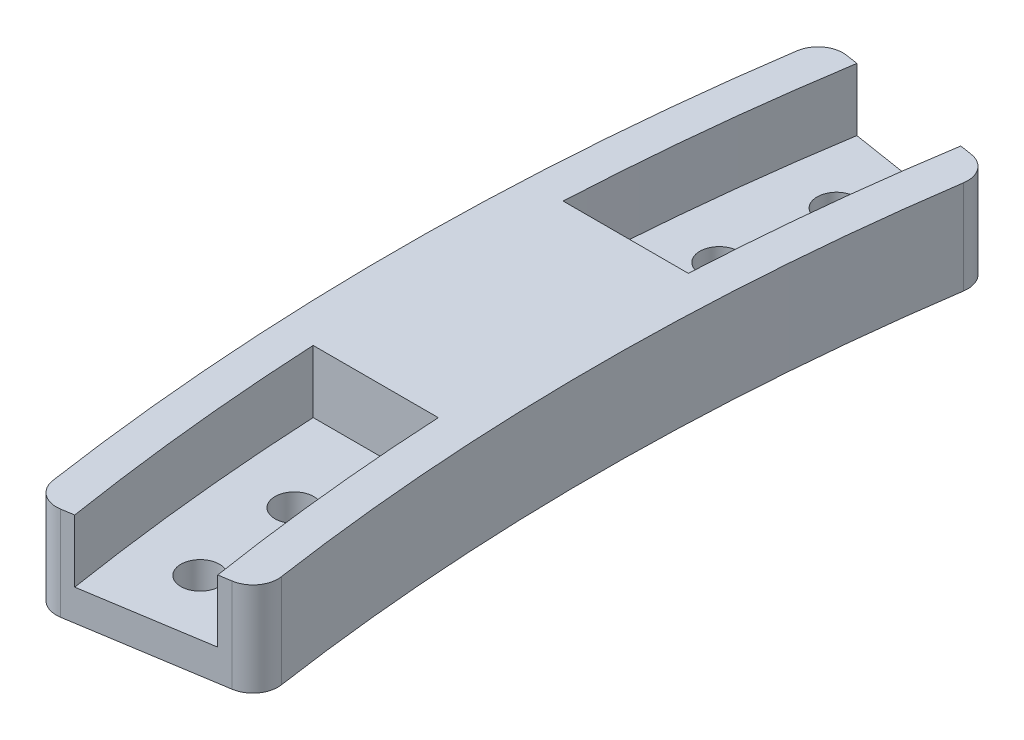
from build123d import *

# Parameters (mm, degrees)
BOSS_EXTRUDE1_DEPTH        = 10
CUT_EXTRUDE1_DEPTH         = 5
F_3_1_3_1_DIAMETER_HOLE2_D = 3.1
FILLET1_R                  = 2
CUT_EXTRUDE2_START         = -2.5
CUT_EXTRUDE2_DEPTH         = 2.5


with BuildPart() as part:
    # Sketch1 → Boss-Extrude1 (new body)
    with BuildSketch(Plane(origin=(0, 0, 0), x_dir=(1, 0, 0), z_dir=(0, 1, 0))):
        with BuildLine():
            Line((-200.500733141, -31.756196403), (-184.697719691, -29.253244963))
            ThreePointArc((-184.697719691, -29.253244963), (-187, 0), (-184.697719691, 29.253244963))
            Line((-184.697719691, 29.253244963), (-200.500733141, 31.756196403))
            ThreePointArc((-200.500733141, 31.756196403), (-203, 0), (-200.500733141, -31.756196403))
        make_face()
    extrude(amount=BOSS_EXTRUDE1_DEPTH)

    # Sketch15 → Cut-Extrude1 (cut)
    with BuildSketch(Plane(origin=(0, 10, 0), x_dir=(1, 0, 0), z_dir=(0, 1, 0))):
        with BuildLine():
            Line((-199.749843554, 10), (-189.73665961, 10))
            ThreePointArc((-189.73665961, 10), (-188.956218405, 19.88837666), (-187.660784713, 29.722548358))
            Line((-187.660784713, 29.722548358), (-197.537668119, 31.286893008))
            ThreePointArc((-197.537668119, 31.286893008), (-198.928692466, 20.673057674), (-199.749843554, 10))
        make_face()
        with BuildLine():
            ThreePointArc((-187.660784713, -29.722548358), (-188.956218405, -19.88837666), (-189.73665961, -10))
            Line((-189.73665961, -10), (-199.749843554, -10))
            ThreePointArc((-199.749843554, -10), (-198.928692466, -20.673057674), (-197.537668119, -31.286893008))
            Line((-197.537668119, -31.286893008), (-187.660784713, -29.722548358))
        make_face()
    extrude(amount=-CUT_EXTRUDE1_DEPTH, mode=Mode.SUBTRACT)

    # Ø3.1 (3.1) Diameter Hole2 (through all)
    with Locations(Plane(origin=(0, 0, 0), x_dir=(-1, 0, 0), z_dir=(0, -1, 0))):
        with Locations((193.331747968, -25.452607483), (194.257966128, -16.995369836), (194.257966128, 16.995369836), (193.331747968, 25.452607483)):
            Hole(F_3_1_3_1_DIAMETER_HOLE2_D / 2)

    # Fillet1
    fillet1_edges = [part.edges().sort_by_distance(p)[0] for p in [
        (-200.500733141, 5, -31.756196403),
        (-184.697719691, 5, -29.253244963),
        (-200.500733141, 5, 31.756196403),
        (-184.697719691, 5, 29.253244963),
    ]]
    fillet(fillet1_edges, radius=FILLET1_R)

    # Sketch19 → Cut-Extrude2 (cut)
    with BuildSketch(Plane.XZ.offset(CUT_EXTRUDE2_START)):
        with BuildLine():
            Line((-198.515528472, -31.441770873), (-186.662644351, -29.564458455))
            ThreePointArc((-186.662644351, -29.564458455), (-185.363721979, -28.773196969), (-184.996936421, -27.297133819))
            ThreePointArc((-184.996936421, -27.297133819), (-187, 0), (-184.996936421, 27.297133819))
            ThreePointArc((-184.996936421, 27.297133819), (-185.363721979, 28.773196969), (-186.662644351, 29.564458455))
            Line((-186.662644351, 29.564458455), (-198.515528472, 31.441770873))
            ThreePointArc((-198.515528472, 31.441770873), (-200.012003377, 31.078559473), (-200.806789416, 29.759592144))
            ThreePointArc((-200.806789416, 29.759592144), (-203, 0), (-200.806789416, -29.759592144))
            ThreePointArc((-200.806789416, -29.759592144), (-200.012003377, -31.078559473), (-198.515528472, -31.441770873))
        make_face()
    extrude(amount=CUT_EXTRUDE2_DEPTH, mode=Mode.SUBTRACT)


solid = part.part
